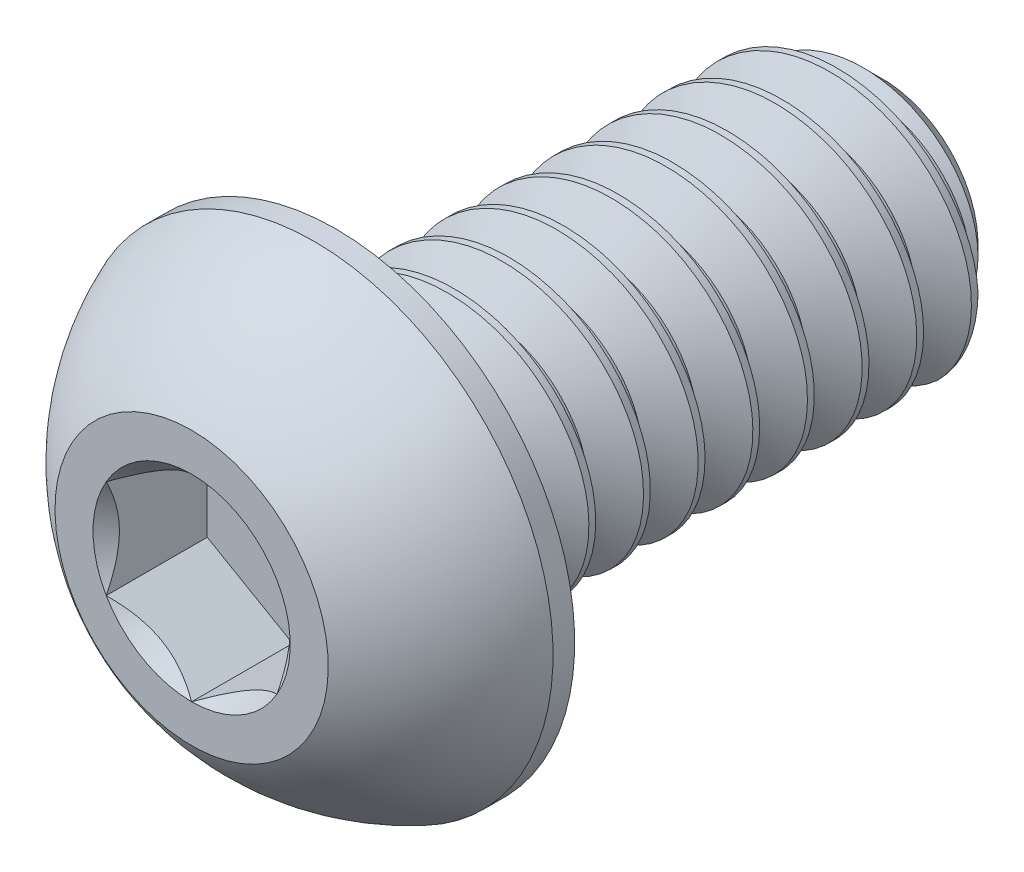
from build123d import *

# Parameters (mm, degrees)
CUT_EXTRUDE2_DEPTH = 2.34696
CHAMFER1_SIZE      = 0.9525
CUT_SWEEP1_PITCH   = 1.27
CUT_SWEEP1_TO      = 12.7


with BuildPart() as part:
    # Sketch12 → Revolve3 (revolve)
    with BuildSketch(Plane(origin=(0, 0, 0), x_dir=(0, 0, -1), z_dir=(1, 0, 0)), mode=Mode.PRIVATE) as revolve3_sk:
        with BuildLine():
            Line((-9.7028, 0), (-9.7028, 3.175))
            ThreePointArc((-9.7028, 3.175), (-8.466878925, 4.58927271), (-6.85292, 5.5499))
            Line((-6.85292, 5.5499), (-6.35, 5.5499))
            Line((-6.35, 5.5499), (-6.35, 3.175))
            Line((-6.35, 3.175), (6.35, 3.175))
            Line((6.35, 3.175), (6.35, 0))
            Line((6.35, 0), (-9.7028, 0))
        make_face()
    revolve(revolve3_sk.sketch.rotate(Axis((0, 0, 9.7028), (0, 0, -1)), 180), axis=Axis((0, 0, 9.7028), (0, 0, -1)))

    # Sketch5 → Cut-Extrude2 (cut)
    with BuildSketch(Plane.XY.offset(9.7028)):
        Polygon((1.984375, -1.14567944), (1.984375, 1.14567944), (0, 2.291358881), (-1.984375, 1.14567944), (-1.984375, -1.14567944), (0, -2.291358881), align=None)
    extrude(amount=-CUT_EXTRUDE2_DEPTH, mode=Mode.SUBTRACT)

    # Cut-Extrude3 cone 1 section (through the dimple's axis) → Cut-Extrude3 (revolve, cut)
    with BuildSketch(Plane(origin=(0, 0, 9.7028), x_dir=(0, -1, 0), z_dir=(1, 0, 0))):
        Polygon((0, 0), (2.291358881, 0), (0, 2.291358881), align=None)
    revolve(axis=Axis((0, 0, 9.7028), (0, 0, -1)), mode=Mode.SUBTRACT)

    # Chamfer1
    chamfer1_edges = [part.edges().sort_by_distance(p)[0] for p in [
        (0, 3.175, -6.35),
    ]]
    chamfer(chamfer1_edges, length=CHAMFER1_SIZE)


with BuildPart() as body_2:
    # Split1: read off the stored shape, not the designer's step
    # Split1: the piece on the far side of the plane
    add(part.part)
    split(bisect_by=Plane.XY.offset(6.35), keep=Keep.BOTTOM)

    # Cut-Sweep1: arcs per turn and ends read off the stored shape
    # Cut-Sweep1: the profile of Sketch14 screwed along a right-hand helix through 11 turns, 8 arcs to a turn; built about Z, then put on its axis
    cut_sweep1_z = Axis((0, 0, 0), (0, 0, 1))
    cut_sweep1_corners = [(2.350110803, 0, -0.47625), (2.350110803, 0, -0.635), (3.243740766, 0, -1.1509375), (3.243740766, 0, 0.0396875)]
    with BuildLine(mode=Mode.PRIVATE) as cut_sweep1_profile:
        Line(cut_sweep1_corners[0], cut_sweep1_corners[1])
        Line(cut_sweep1_corners[1], cut_sweep1_corners[2])
        Line(cut_sweep1_corners[2], cut_sweep1_corners[3])
        Line(cut_sweep1_corners[3], cut_sweep1_corners[0])
    cut_sweep1_cap = Face(cut_sweep1_profile.wire())
    cut_sweep1_turn_angles = [0, 22.5, 45, 67.5, 90, 112.5, 135, 157.5, 180, 202.5, 225, 247.5, 270, 292.5, 315, 337.5, 360]
    cut_sweep1_turn_weights = [1, 0.9238795325112867, 1, 0.9238795325112867, 1, 0.9238795325112867, 1, 0.9238795325112867, 1, 0.9238795325112867, 1, 0.9238795325112867, 1, 0.9238795325112867, 1, 0.9238795325112867, 1]
    cut_sweep1_turn_rails = [Edge.make_bspline([Vector(p[0], p[1], 0).rotate(cut_sweep1_z, cut_sweep1_turn_angles[k]) / cut_sweep1_turn_weights[k] + Vector(0, 0, p[2] + CUT_SWEEP1_PITCH * cut_sweep1_turn_angles[k] / 360) for k in range(17)], [0, 0, 0, 1, 1, 2, 2, 3, 3, 4, 4, 5, 5, 6, 6, 7, 7, 8, 8, 8], 2, cut_sweep1_turn_weights) for p in cut_sweep1_corners]
    cut_sweep1_turn_sides = [Face.make_surface_from_curves(cut_sweep1_turn_rails[p[0]], cut_sweep1_turn_rails[p[1]]) for p in [(0, 1), (1, 2), (2, 3), (3, 0)]]
    cut_sweep1 = Plane(origin=(0, 0, -6.35), x_dir=(0, 1, 0), z_dir=(0, 0, 1)) * split(Solid(Shell([*[p.moved(Location((0, 0, CUT_SWEEP1_PITCH * i))) for i in range(11) for p in cut_sweep1_turn_sides], cut_sweep1_cap, cut_sweep1_cap.rotate(cut_sweep1_z, 3960).moved(Location((0, 0, CUT_SWEEP1_PITCH * 3960 / 360)))])), bisect_by=Plane.XY.offset(CUT_SWEEP1_TO), keep=Keep.BOTTOM, mode=Mode.PRIVATE)
    add(cut_sweep1, mode=Mode.SUBTRACT)


with BuildPart() as part_1:
    add(part.part)

    # Split1
    split(bisect_by=Plane.XY.offset(6.35), keep=Keep.TOP)

    add(body_2.part)  # Boss-Extrude4 merges body 2
    # Boss-Extrude4: read off the stored shape, not the designer's step
    # Boss-Extrude4 outline → Boss-Extrude4 (revolve)
    with BuildSketch(Plane.XZ):
        Polygon((2.350109328, 6.35), (2.350109328, 4.083631506), (3.175, 6.35), align=None)
    revolve(axis=Axis((0, 0, 0), (0, 0, 1)))


solid = part_1.part
